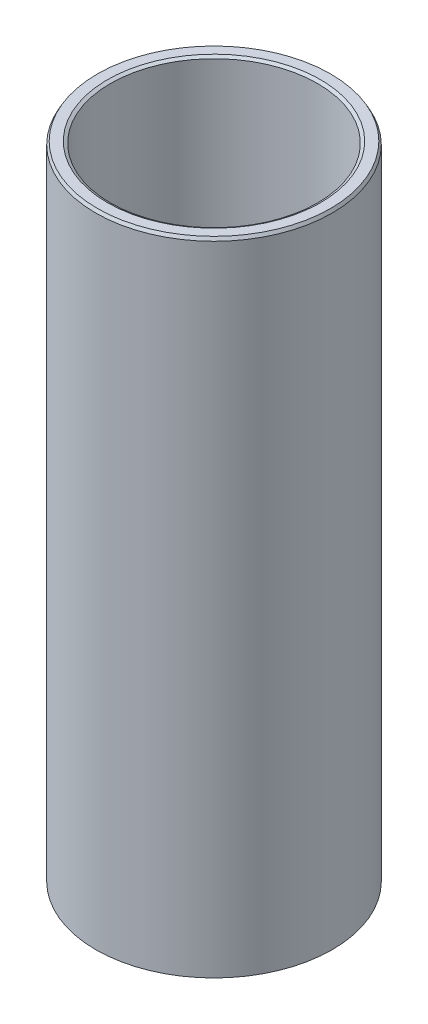
from build123d import *
from OCP.BRepFilletAPI import BRepFilletAPI_MakeChamfer

# Parameters (mm, degrees)
SKETCH1_R           = 42.5
BOSS_EXTRUDE1_DEPTH = 230.88460001
SKETCH2_R           = 37.183408751
CUT_EXTRUDE1_DEPTH  = 239.579543385
CHAMFER1_SIZE       = 1.097731846
CHAMFER1_SIZE2      = 0.62789483


with BuildPart() as part:
    # Sketch1 → Boss-Extrude1 (new body)
    with BuildSketch(Plane(origin=(0, 0, 0), x_dir=(1, 0, 0), z_dir=(0, 1, 0))):
        Circle(SKETCH1_R)
    extrude(amount=BOSS_EXTRUDE1_DEPTH)

    # Sketch2 → Cut-Extrude1 (cut, through all)
    with BuildSketch(Plane(origin=(0, 0, 0), x_dir=(1, 0, 0), z_dir=(0, 1, 0))):
        Circle(SKETCH2_R)
    extrude(amount=CUT_EXTRUDE1_DEPTH, mode=Mode.SUBTRACT)

    # Chamfer1: one chamfer whose edges measure the first distance from different faces: ONE call of the kernel's chamfer builder (chamfer() names one face for all edges)
    chamfer1_edges_1 = [part.edges().sort_by_distance(p)[0] for p in [
        (-37.183408751, 230.88460001, 0),
    ]]
    chamfer1_side_1 = [part.faces().sort_by_distance(p)[0] for p in [
        (-41.297918472, 230.88460001, 0),
    ]]
    chamfer1_edges_2 = [part.edges().sort_by_distance(p)[0] for p in [
        (-37.183408751, 0, 0),
    ]]
    chamfer1_side_2 = [part.faces().sort_by_distance(p)[0] for p in [
        (-37.183408751, 115.442300005, 0),
    ]]
    chamfer1_edges_3 = [part.edges().sort_by_distance(p)[0] for p in [
        (-42.5, 0, 0),
    ]]
    chamfer1_side_3 = [part.faces().sort_by_distance(p)[0] for p in [
        (-41.297918472, 0, 0),
    ]]
    chamfer1_edges_4 = [part.edges().sort_by_distance(p)[0] for p in [
        (-42.5, 230.88460001, 0),
    ]]
    chamfer1_side_4 = [part.faces().sort_by_distance(p)[0] for p in [
        (-42.5, 115.442300005, 0),
    ]]
    chamfer1 = BRepFilletAPI_MakeChamfer(part.part.solid().wrapped)
    for e in chamfer1_edges_1:
        chamfer1.Add(CHAMFER1_SIZE, CHAMFER1_SIZE2, e.wrapped, chamfer1_side_1[0].wrapped)  # the first distance lies on this face
    for e in chamfer1_edges_2:
        chamfer1.Add(CHAMFER1_SIZE, CHAMFER1_SIZE2, e.wrapped, chamfer1_side_2[0].wrapped)  # the first distance lies on this face
    for e in chamfer1_edges_3:
        chamfer1.Add(CHAMFER1_SIZE, CHAMFER1_SIZE2, e.wrapped, chamfer1_side_3[0].wrapped)  # the first distance lies on this face
    for e in chamfer1_edges_4:
        chamfer1.Add(CHAMFER1_SIZE, CHAMFER1_SIZE2, e.wrapped, chamfer1_side_4[0].wrapped)  # the first distance lies on this face
    add(Compound.cast(chamfer1.Shape()), mode=Mode.REPLACE)


solid = part.part
